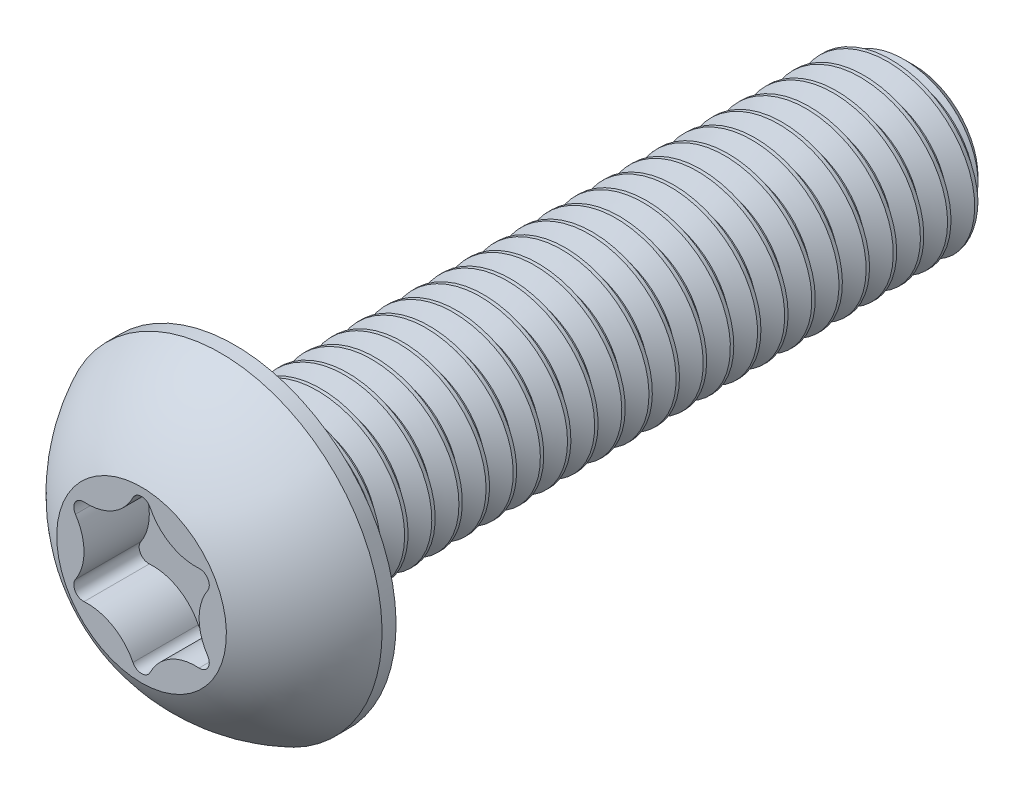
from build123d import *

# Parameters (mm, degrees)
SKETCH12_W         = 20
SKETCH12_H         = 2.5
CUT_EXTRUDE4_DEPTH = 1.925
CIRPATTERN1_COUNT  = 6
CHAMFER1_SIZE      = 0.6
CUT_SWEEP1_PITCH   = 0.8
CUT_SWEEP1_TO      = 20


with BuildPart() as part:
    # Sketch12 → Revolve1 (revolve)
    with BuildSketch(Plane(origin=(0, 0, 0), x_dir=(0, 0, -1), z_dir=(1, 0, 0))):
        with Locations((0, 1.25)):
            Rectangle(SKETCH12_W, SKETCH12_H)
    revolve(axis=Axis((0, 0, -10), (0, 0, 1)))

    # Sketch7 → Revolve2 (revolve)
    with BuildSketch(Plane(origin=(0, 0, 0), x_dir=(0, 0, -1), z_dir=(1, 0, 0)), mode=Mode.PRIVATE) as revolve2_sk:
        with BuildLine():
            Line((-10.4125, 4.75), (-10, 4.75))
            Line((-10, 4.75), (-10, 0))
            Line((-10, 0), (-12.75, 0))
            Line((-12.75, 0), (-12.75, 2.5))
            ThreePointArc((-12.75, 2.5), (-11.758124817, 3.808753282), (-10.4125, 4.75))
        make_face()
    revolve(revolve2_sk.sketch.rotate(Axis((0, 0, 12.75), (0, 0, -1)), 180), axis=Axis((0, 0, 12.75), (0, 0, -1)))

    # Sketch11 → Cut-Extrude4 (cut)
    with BuildSketch(Plane.XY.offset(12.75)):
        with BuildLine():
            Line((0, 0), (-1.957910233, 1.1304))
            ThreePointArc((-1.957910233, 1.1304), (-1.995619021, 0.979819267), (-1.948106604, 0.832038754))
            ThreePointArc((-1.948106604, 0.832038754), (-1.6956, 0), (-1.948106604, -0.832038754))
            ThreePointArc((-1.948106604, -0.832038754), (-1.995619021, -0.979819267), (-1.957910233, -1.1304))
            Line((-1.957910233, -1.1304), (0, 0))
        make_face()
    cut_extrude4 = extrude(amount=-CUT_EXTRUDE4_DEPTH, mode=Mode.SUBTRACT)

    # CirPattern1: Cut-Extrude4 ×6 about axis
    cirpattern1_axis = Axis((0, 0, 0), (0, 0, -1))
    for i in range(1, CIRPATTERN1_COUNT):
        add(cut_extrude4.rotate(cirpattern1_axis, i * 360 / CIRPATTERN1_COUNT), mode=Mode.SUBTRACT)

    # Chamfer1
    chamfer1_edges = [part.edges().sort_by_distance(p)[0] for p in [
        (0, -2.5, -10),
    ]]
    chamfer(chamfer1_edges, length=CHAMFER1_SIZE)


with BuildPart() as body_2:
    # Split1: read off the stored shape, not the designer's step
    # Split1: the piece on the far side of the plane
    add(part.part)
    split(bisect_by=Plane.XY.offset(10), keep=Keep.BOTTOM)

    # Cut-Sweep1: arcs per turn and ends read off the stored shape
    # Cut-Sweep1: the profile of Sketch14 screwed along a right-hand helix through 26 turns, 8 arcs to a turn; built about Z, then put on its axis
    cut_sweep1_z = Axis((0, 0, 0), (0, 0, 1))
    cut_sweep1_corners = [(1.980384758, 0, -0.3), (2.54330127, 0, 0.025), (2.54330127, 0, -0.725), (1.980384758, 0, -0.4)]
    with BuildLine(mode=Mode.PRIVATE) as cut_sweep1_profile:
        Line(cut_sweep1_corners[0], cut_sweep1_corners[1])
        Line(cut_sweep1_corners[1], cut_sweep1_corners[2])
        Line(cut_sweep1_corners[2], cut_sweep1_corners[3])
        Line(cut_sweep1_corners[3], cut_sweep1_corners[0])
    cut_sweep1_cap = Face(cut_sweep1_profile.wire())
    cut_sweep1_turn_angles = [0, 22.5, 45, 67.5, 90, 112.5, 135, 157.5, 180, 202.5, 225, 247.5, 270, 292.5, 315, 337.5, 360]
    cut_sweep1_turn_weights = [1, 0.9238795325112867, 1, 0.9238795325112867, 1, 0.9238795325112867, 1, 0.9238795325112867, 1, 0.9238795325112867, 1, 0.9238795325112867, 1, 0.9238795325112867, 1, 0.9238795325112867, 1]
    cut_sweep1_turn_rails = [Edge.make_bspline([Vector(p[0], p[1], 0).rotate(cut_sweep1_z, cut_sweep1_turn_angles[k]) / cut_sweep1_turn_weights[k] + Vector(0, 0, p[2] + CUT_SWEEP1_PITCH * cut_sweep1_turn_angles[k] / 360) for k in range(17)], [0, 0, 0, 1, 1, 2, 2, 3, 3, 4, 4, 5, 5, 6, 6, 7, 7, 8, 8, 8], 2, cut_sweep1_turn_weights) for p in cut_sweep1_corners]
    cut_sweep1_turn_sides = [Face.make_surface_from_curves(cut_sweep1_turn_rails[p[0]], cut_sweep1_turn_rails[p[1]]) for p in [(0, 1), (1, 2), (2, 3), (3, 0)]]
    cut_sweep1 = Plane(origin=(0, 0, -10), x_dir=(0, 1, 0), z_dir=(0, 0, 1)) * split(Solid(Shell([*[p.moved(Location((0, 0, CUT_SWEEP1_PITCH * i))) for i in range(26) for p in cut_sweep1_turn_sides], cut_sweep1_cap, cut_sweep1_cap.rotate(cut_sweep1_z, 9360).moved(Location((0, 0, CUT_SWEEP1_PITCH * 9360 / 360)))])), bisect_by=Plane.XY.offset(CUT_SWEEP1_TO), keep=Keep.BOTTOM, mode=Mode.PRIVATE)
    add(cut_sweep1, mode=Mode.SUBTRACT)


with BuildPart() as part_1:
    add(part.part)

    # Split1
    split(bisect_by=Plane.XY.offset(10), keep=Keep.TOP)

    # Combine1: union body 2
    add(body_2.part)


solid = part_1.part
